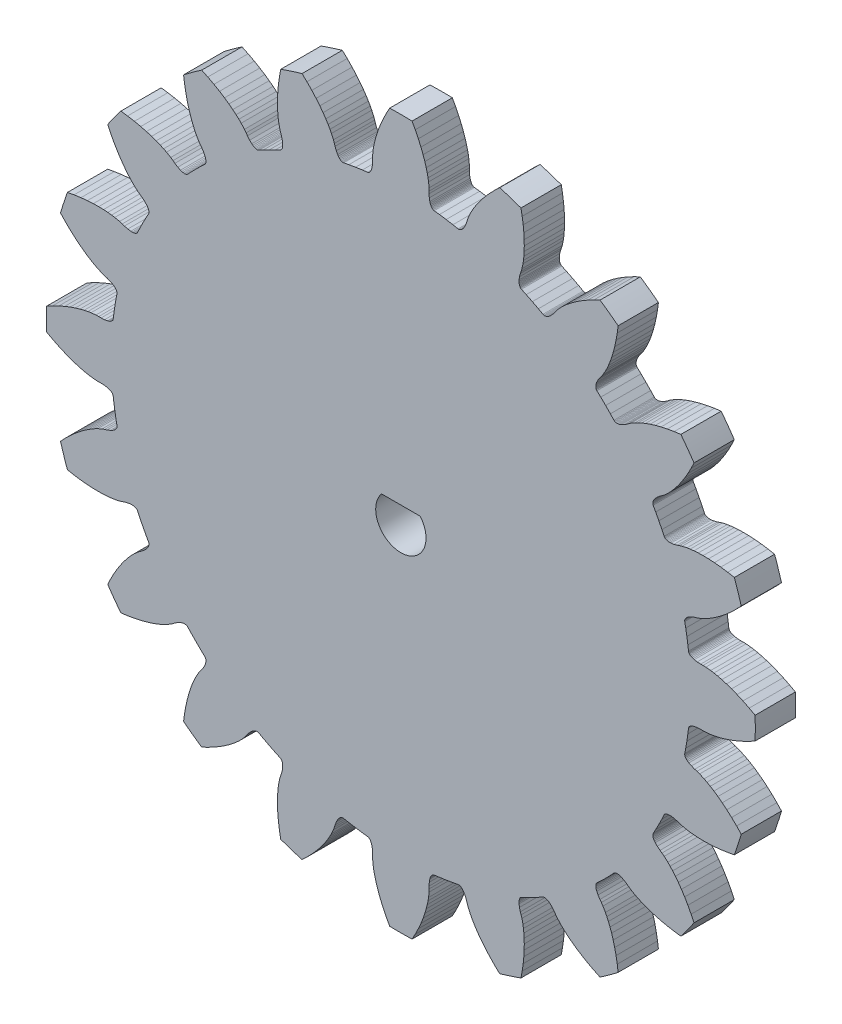
from build123d import *

# Parameters (mm, degrees)
MODEL_R             = 0.5
BOSS_EXTRUDE1_DEPTH = 5
CUT_EXTRUDE1_DEPTH  = 63.425869445
BOSS_EXTRUDE2_START = 10
SKETCH3_R           = 8
BOSS_EXTRUDE2_DEPTH = 10
SKETCH5_R           = 2.05
CUT_EXTRUDE2_DEPTH  = 10


with BuildPart() as part:
    # Model → Boss-Extrude1 (new body)
    with BuildSketch(Plane.XY):
        with BuildLine():
            Line((41.0580513, 11.0594647), (41.6786239, 11.6621942))
            Line((41.6786239, 11.6621942), (42.254799591, 12.268924064))
            ThreePointArc((42.254799591, 12.268924064), (41.846428175, 13.596728691), (41.396343585, 14.910979886))
            Line((41.396343585, 14.910979886), (40.5735808, 15.0631672))
            Line((40.5735808, 15.0631672), (39.7172515, 15.1860222))
            Line((39.7172515, 15.1860222), (38.9209581, 15.2664261))
            Line((38.9209581, 15.2664261), (38.188074, 15.3095207))
            Line((38.188074, 15.3095207), (37.5212498, 15.3207867))
            Line((37.5212498, 15.3207867), (36.9192091, 15.3057692))
            Line((36.9192091, 15.3057692), (36.385219, 15.2700607))
            Line((36.385219, 15.2700607), (35.9182805, 15.2191681))
            Line((35.9182805, 15.2191681), (35.519022, 15.1586865))
            Line((35.519022, 15.1586865), (34.9229912, 15.031255))
            Line((34.9229912, 15.031255), (34.5912709, 14.9315723))
            Line((34.5912709, 14.9315723), (34.3145829, 14.8346777))
            Line((34.3145829, 14.8346777), (33.8996768, 14.7245961))
            Line((33.8996768, 14.7245961), (33.5375203, 14.6729516))
            Line((33.5375203, 14.6729516), (33.3775076, 14.6675821))
            Line((33.3775076, 14.6675821), (33.232174, 14.6750343))
            Line((33.232174, 14.6750343), (33.1019936, 14.6947079))
            Line((33.1019936, 14.6947079), (32.9874095, 14.7259534))
            Line((32.9874095, 14.7259534), (32.8888203, 14.7681208))
            Line((32.8888203, 14.7681208), (32.8066469, 14.8205604))
            Line((32.8066469, 14.8205604), (32.74127, 14.8825908))
            Line((32.74127, 14.8825908), (32.6837041, 14.9725741))
            Line((32.6837041, 14.9725741), (32.4071065, 15.5624769))
            Line((32.4071065, 15.5624769), (32.0316845, 16.3209585))
            Line((32.0316845, 16.3209585), (31.6387276, 17.0705055))
            Line((31.6387276, 17.0705055), (31.3240661, 17.6410139))
            Line((31.3240661, 17.6410139), (31.2851045, 17.7404764))
            Line((31.2851045, 17.7404764), (31.2733484, 17.829828))
            Line((31.2733484, 17.829828), (31.2792242, 17.927131))
            Line((31.2792242, 17.927131), (31.3030593, 18.0316767))
            Line((31.3030593, 18.0316767), (31.345132, 18.1427428))
            Line((31.345132, 18.1427428), (31.4057339, 18.2596248))
            Line((31.4057339, 18.2596248), (31.48513, 18.3815824))
            Line((31.48513, 18.3815824), (31.583527, 18.5078793))
            Line((31.583527, 18.5078793), (31.8381786, 18.7705142))
            Line((31.8381786, 18.7705142), (32.1711122, 19.0414759))
            Line((32.1711122, 19.0414759), (32.4121346, 19.208368))
            Line((32.4121346, 19.208368), (32.6877599, 19.4181434))
            Line((32.6877599, 19.4181434), (33.1411923, 19.8254401))
            Line((33.1411923, 19.8254401), (33.4248012, 20.1128967))
            Line((33.4248012, 20.1128967), (33.7404338, 20.460744))
            Line((33.7404338, 20.460744), (34.083194, 20.8717622))
            Line((34.083194, 20.8717622), (34.4492141, 21.3499962))
            Line((34.4492141, 21.3499962), (34.8320491, 21.8960904))
            Line((34.8320491, 21.8960904), (35.2279633, 22.5143365))
            Line((35.2279633, 22.5143365), (35.6309647, 23.2058115))
            Line((35.6309647, 23.2058115), (36.0349107, 23.9708089))
            Line((36.0349107, 23.9708089), (36.395396459, 24.725891411))
            ThreePointArc((36.395396459, 24.725891411), (35.596697995, 25.862514918), (34.762516187, 26.973358268))
            Line((34.762516187, 26.973358268), (33.9329938, 26.8638493))
            Line((33.9329938, 26.8638493), (33.0806119, 26.716071))
            Line((33.0806119, 26.716071), (32.2984457, 26.5464715))
            Line((32.2984457, 26.5464715), (31.5881145, 26.3609832))
            Line((31.5881145, 26.3609832), (30.9504457, 26.1656379))
            Line((30.9504457, 26.1656379), (30.3825116, 25.9653146))
            Line((30.3825116, 25.9653146), (29.8856913, 25.7663418))
            Line((29.8856913, 25.7663418), (29.4573331, 25.5736481))
            Line((29.4573331, 25.5736481), (29.0963056, 25.392749))
            Line((29.0963056, 25.392749), (28.5688252, 25.0873708))
            Line((28.5688252, 25.0873708), (28.284144, 24.8900597))
            Line((28.284144, 24.8900597), (28.0509402, 24.7124062))
            Line((28.0509402, 24.7124062), (27.6903581, 24.4794994))
            Line((27.6903581, 24.4794994), (27.3618858, 24.3184699))
            Line((27.3618858, 24.3184699), (27.211364, 24.2639166))
            Line((27.211364, 24.2639166), (27.0708407, 24.2260935))
            Line((27.0708407, 24.2260935), (26.9409522, 24.2045762))
            Line((26.9409522, 24.2045762), (26.8223209, 24.198884))
            Line((26.8223209, 24.198884), (26.7155266, 24.2085219))
            Line((26.7155266, 24.2085219), (26.6211702, 24.2330019))
            Line((26.6211702, 24.2330019), (26.5398247, 24.2717938))
            Line((26.5398247, 24.2717938), (26.45727, 24.3395841))
            Line((26.45727, 24.3395841), (26.01192, 24.8151417))
            Line((26.01192, 24.8151417), (25.4204888, 25.4204888))
            Line((25.4204888, 25.4204888), (24.8151417, 26.01192))
            Line((24.8151417, 26.01192), (24.3395841, 26.45727))
            Line((24.3395841, 26.45727), (24.2717938, 26.5398247))
            Line((24.2717938, 26.5398247), (24.2330019, 26.6211702))
            Line((24.2330019, 26.6211702), (24.2085219, 26.7155266))
            Line((24.2085219, 26.7155266), (24.198884, 26.8223209))
            Line((24.198884, 26.8223209), (24.2045762, 26.9409522))
            Line((24.2045762, 26.9409522), (24.2260935, 27.0708407))
            Line((24.2260935, 27.0708407), (24.2639166, 27.211364))
            Line((24.2639166, 27.211364), (24.3184699, 27.3618858))
            Line((24.3184699, 27.3618858), (24.4794994, 27.6903581))
            Line((24.4794994, 27.6903581), (24.7124062, 28.0509402))
            Line((24.7124062, 28.0509402), (24.8900597, 28.284144))
            Line((24.8900597, 28.284144), (25.0873708, 28.5688252))
            Line((25.0873708, 28.5688252), (25.392749, 29.0963056))
            Line((25.392749, 29.0963056), (25.5736481, 29.4573331))
            Line((25.5736481, 29.4573331), (25.7663418, 29.8856913))
            Line((25.7663418, 29.8856913), (25.9653146, 30.3825116))
            Line((25.9653146, 30.3825116), (26.1656379, 30.9504457))
            Line((26.1656379, 30.9504457), (26.3609832, 31.5881145))
            Line((26.3609832, 31.5881145), (26.5464715, 32.2984457))
            Line((26.5464715, 32.2984457), (26.716071, 33.0806119))
            Line((26.716071, 33.0806119), (26.8638493, 33.9329938))
            Line((26.8638493, 33.9329938), (26.973358307, 34.762516234))
            ThreePointArc((26.973358307, 34.762516234), (25.862514956, 35.59669804), (24.725891448, 36.395396503))
            Line((24.725891448, 36.395396503), (23.9708089, 36.0349107))
            Line((23.9708089, 36.0349107), (23.2058115, 35.6309647))
            Line((23.2058115, 35.6309647), (22.5143365, 35.2279633))
            Line((22.5143365, 35.2279633), (21.8960904, 34.8320491))
            Line((21.8960904, 34.8320491), (21.3499962, 34.4492141))
            Line((21.3499962, 34.4492141), (20.8717622, 34.083194))
            Line((20.8717622, 34.083194), (20.460744, 33.7404338))
            Line((20.460744, 33.7404338), (20.1128967, 33.4248012))
            Line((20.1128967, 33.4248012), (19.8254401, 33.1411923))
            Line((19.8254401, 33.1411923), (19.4181434, 32.6877599))
            Line((19.4181434, 32.6877599), (19.208368, 32.4121346))
            Line((19.208368, 32.4121346), (19.0414759, 32.1711122))
            Line((19.0414759, 32.1711122), (18.7705142, 31.8381786))
            Line((18.7705142, 31.8381786), (18.5078793, 31.583527))
            Line((18.5078793, 31.583527), (18.3815824, 31.48513))
            Line((18.3815824, 31.48513), (18.2596248, 31.4057339))
            Line((18.2596248, 31.4057339), (18.1427428, 31.345132))
            Line((18.1427428, 31.345132), (18.0316767, 31.3030593))
            Line((18.0316767, 31.3030593), (17.927131, 31.2792242))
            Line((17.927131, 31.2792242), (17.829828, 31.2733484))
            Line((17.829828, 31.2733484), (17.7404764, 31.2851045))
            Line((17.7404764, 31.2851045), (17.6410139, 31.3240661))
            Line((17.6410139, 31.3240661), (17.0705055, 31.6387276))
            Line((17.0705055, 31.6387276), (16.3209585, 32.0316845))
            Line((16.3209585, 32.0316845), (15.5624769, 32.4071065))
            Line((15.5624769, 32.4071065), (14.9725741, 32.6837041))
            Line((14.9725741, 32.6837041), (14.8825908, 32.74127))
            Line((14.8825908, 32.74127), (14.8205604, 32.8066469))
            Line((14.8205604, 32.8066469), (14.7681208, 32.8888203))
            Line((14.7681208, 32.8888203), (14.7259534, 32.9874095))
            Line((14.7259534, 32.9874095), (14.6947079, 33.1019936))
            Line((14.6947079, 33.1019936), (14.6750343, 33.232174))
            Line((14.6750343, 33.232174), (14.6675821, 33.3775076))
            Line((14.6675821, 33.3775076), (14.6729516, 33.5375203))
            Line((14.6729516, 33.5375203), (14.7245961, 33.8996768))
            Line((14.7245961, 33.8996768), (14.8346777, 34.3145829))
            Line((14.8346777, 34.3145829), (14.9315723, 34.5912709))
            Line((14.9315723, 34.5912709), (15.031255, 34.9229912))
            Line((15.031255, 34.9229912), (15.1586865, 35.519022))
            Line((15.1586865, 35.519022), (15.2191681, 35.9182805))
            Line((15.2191681, 35.9182805), (15.2700607, 36.385219))
            Line((15.2700607, 36.385219), (15.3057692, 36.9192091))
            Line((15.3057692, 36.9192091), (15.3207867, 37.5212498))
            Line((15.3207867, 37.5212498), (15.3095207, 38.188074))
            Line((15.3095207, 38.188074), (15.2664261, 38.9209581))
            Line((15.2664261, 38.9209581), (15.1860222, 39.7172515))
            Line((15.1860222, 39.7172515), (15.0631672, 40.5735808))
            Line((15.0631672, 40.5735808), (14.910979886, 41.396343585))
            ThreePointArc((14.910979886, 41.396343585), (13.596728691, 41.846428175), (12.268924064, 42.254799591))
            Line((12.268924064, 42.254799591), (11.6621942, 41.6786239))
            Line((11.6621942, 41.6786239), (11.0594647, 41.0580513))
            Line((11.0594647, 41.0580513), (10.5263671, 40.4610966))
            Line((10.5263671, 40.4610966), (10.0607243, 39.8935113))
            Line((10.0607243, 39.8935113), (9.6596604, 39.3606612))
            Line((9.6596604, 39.3606612), (9.3179393, 38.864773))
            Line((9.3179393, 38.864773), (9.0329565, 38.411777))
            Line((9.0329565, 38.411777), (8.7996699, 38.0041019))
            Line((8.7996699, 38.0041019), (8.6139223, 37.6455448))
            Line((8.6139223, 37.6455448), (8.3666785, 37.0884434))
            Line((8.3666785, 37.0884434), (8.2523431, 36.761484))
            Line((8.2523431, 36.761484), (8.1680994, 36.4806855))
            Line((8.1680994, 36.4806855), (8.0132816, 36.0803151))
            Line((8.0132816, 36.0803151), (7.8421926, 35.7569684))
            Line((7.8421926, 35.7569684), (7.7524835, 35.6243594))
            Line((7.7524835, 35.6243594), (7.6610297, 35.5111623))
            Line((7.6610297, 35.5111623), (7.5685952, 35.4174079))
            Line((7.5685952, 35.4174079), (7.4759663, 35.3430731))
            Line((7.4759663, 35.3430731), (7.3839029, 35.2880982))
            Line((7.3839029, 35.2880982), (7.293178, 35.2524417))
            Line((7.293178, 35.2524417), (7.2045667, 35.2360112))
            Line((7.2045667, 35.2360112), (7.0979324, 35.2423303))
            Line((7.0979324, 35.2423303), (6.458111, 35.3652943))
            Line((6.458111, 35.3652943), (5.623819, 35.5073958))
            Line((5.623819, 35.5073958), (4.7864484, 35.6300597))
            Line((4.7864484, 35.6300597), (4.1399441, 35.7108296))
            Line((4.1399441, 35.7108296), (4.0365761, 35.7377716))
            Line((4.0365761, 35.7377716), (3.9573791, 35.7807803))
            Line((3.9573791, 35.7807803), (3.8821131, 35.8427272))
            Line((3.8821131, 35.8427272), (3.8115438, 35.9234606))
            Line((3.8115438, 35.9234606), (3.7464191, 36.0227811))
            Line((3.7464191, 36.0227811), (3.6874804, 36.1405106))
            Line((3.6874804, 36.1405106), (3.6354825, 36.2764283))
            Line((3.6354825, 36.2764283), (3.5911425, 36.4302686))
            Line((3.5911425, 36.4302686), (3.5283469, 36.790659))
            Line((3.5283469, 36.790659), (3.5048276, 37.2192752))
            Line((3.5048276, 37.2192752), (3.5114786, 37.5123632))
            Line((3.5114786, 37.5123632), (3.5037752, 37.8586516))
            Line((3.5037752, 37.8586516), (3.4407861, 38.4648891))
            Line((3.4407861, 38.4648891), (3.37493, 38.8632963))
            Line((3.37493, 38.8632963), (3.2790398, 39.3231079))
            Line((3.2790398, 39.3231079), (3.1479885, 39.8419972))
            Line((3.1479885, 39.8419972), (2.9762302, 40.4192126))
            Line((2.9762302, 40.4192126), (2.7594555, 41.0499187))
            Line((2.7594555, 41.0499187), (2.4919965, 41.7336159))
            Line((2.4919965, 41.7336159), (2.1694597, 42.4660898))
            Line((2.1694597, 42.4660898), (1.7879973, 43.2425431))
            Line((1.7879973, 43.2425431), (1.389010873, 43.978008589))
            ThreePointArc((1.389010873, 43.978008589), (-7.7e-08, 43.9999385), (-1.389011027, 43.978008585))
            Line((-1.389011027, 43.978008585), (-1.7879973, 43.2425431))
            Line((-1.7879973, 43.2425431), (-2.1694597, 42.4660898))
            Line((-2.1694597, 42.4660898), (-2.4919965, 41.7336159))
            Line((-2.4919965, 41.7336159), (-2.7594555, 41.0499187))
            Line((-2.7594555, 41.0499187), (-2.9762302, 40.4192126))
            Line((-2.9762302, 40.4192126), (-3.1479885, 39.8419972))
            Line((-3.1479885, 39.8419972), (-3.2790398, 39.3231079))
            Line((-3.2790398, 39.3231079), (-3.37493, 38.8632963))
            Line((-3.37493, 38.8632963), (-3.4407861, 38.4648891))
            Line((-3.4407861, 38.4648891), (-3.5037752, 37.8586516))
            Line((-3.5037752, 37.8586516), (-3.5114786, 37.5123632))
            Line((-3.5114786, 37.5123632), (-3.5048276, 37.2192752))
            Line((-3.5048276, 37.2192752), (-3.5283469, 36.790659))
            Line((-3.5283469, 36.790659), (-3.5911425, 36.4302686))
            Line((-3.5911425, 36.4302686), (-3.6354825, 36.2764283))
            Line((-3.6354825, 36.2764283), (-3.6874804, 36.1405106))
            Line((-3.6874804, 36.1405106), (-3.7464191, 36.0227811))
            Line((-3.7464191, 36.0227811), (-3.8115438, 35.9234606))
            Line((-3.8115438, 35.9234606), (-3.8821131, 35.8427272))
            Line((-3.8821131, 35.8427272), (-3.9573791, 35.7807803))
            Line((-3.9573791, 35.7807803), (-4.0365761, 35.7377716))
            Line((-4.0365761, 35.7377716), (-4.1399441, 35.7108296))
            Line((-4.1399441, 35.7108296), (-4.7864484, 35.6300597))
            Line((-4.7864484, 35.6300597), (-5.623819, 35.5073958))
            Line((-5.623819, 35.5073958), (-6.458111, 35.3652943))
            Line((-6.458111, 35.3652943), (-7.0979324, 35.2423303))
            Line((-7.0979324, 35.2423303), (-7.2045667, 35.2360112))
            Line((-7.2045667, 35.2360112), (-7.293178, 35.2524417))
            Line((-7.293178, 35.2524417), (-7.3839029, 35.2880982))
            Line((-7.3839029, 35.2880982), (-7.4759663, 35.3430731))
            Line((-7.4759663, 35.3430731), (-7.5685952, 35.4174079))
            Line((-7.5685952, 35.4174079), (-7.6610297, 35.5111623))
            Line((-7.6610297, 35.5111623), (-7.7524835, 35.6243594))
            Line((-7.7524835, 35.6243594), (-7.8421926, 35.7569684))
            Line((-7.8421926, 35.7569684), (-8.0132816, 36.0803151))
            Line((-8.0132816, 36.0803151), (-8.1680994, 36.4806855))
            Line((-8.1680994, 36.4806855), (-8.2523431, 36.761484))
            Line((-8.2523431, 36.761484), (-8.3666785, 37.0884434))
            Line((-8.3666785, 37.0884434), (-8.6139223, 37.6455448))
            Line((-8.6139223, 37.6455448), (-8.7996699, 38.0041019))
            Line((-8.7996699, 38.0041019), (-9.0329565, 38.411777))
            Line((-9.0329565, 38.411777), (-9.3179393, 38.864773))
            Line((-9.3179393, 38.864773), (-9.6596604, 39.3606612))
            Line((-9.6596604, 39.3606612), (-10.0607243, 39.8935113))
            Line((-10.0607243, 39.8935113), (-10.5263671, 40.4610966))
            Line((-10.5263671, 40.4610966), (-11.0594647, 41.0580513))
            Line((-11.0594647, 41.0580513), (-11.6621942, 41.6786239))
            Line((-11.6621942, 41.6786239), (-12.268924064, 42.254799591))
            ThreePointArc((-12.268924064, 42.254799591), (-13.596728691, 41.846428175), (-14.910979886, 41.396343585))
            Line((-14.910979886, 41.396343585), (-15.0631672, 40.5735808))
            Line((-15.0631672, 40.5735808), (-15.1860222, 39.7172515))
            Line((-15.1860222, 39.7172515), (-15.2664261, 38.9209581))
            Line((-15.2664261, 38.9209581), (-15.3095207, 38.188074))
            Line((-15.3095207, 38.188074), (-15.3207867, 37.5212498))
            Line((-15.3207867, 37.5212498), (-15.3057692, 36.9192091))
            Line((-15.3057692, 36.9192091), (-15.2700607, 36.385219))
            Line((-15.2700607, 36.385219), (-15.2191681, 35.9182805))
            Line((-15.2191681, 35.9182805), (-15.1586865, 35.519022))
            Line((-15.1586865, 35.519022), (-15.031255, 34.9229912))
            Line((-15.031255, 34.9229912), (-14.9315723, 34.5912709))
            Line((-14.9315723, 34.5912709), (-14.8346777, 34.3145829))
            Line((-14.8346777, 34.3145829), (-14.7245961, 33.8996768))
            Line((-14.7245961, 33.8996768), (-14.6729516, 33.5375203))
            Line((-14.6729516, 33.5375203), (-14.6675821, 33.3775076))
            Line((-14.6675821, 33.3775076), (-14.6750343, 33.232174))
            Line((-14.6750343, 33.232174), (-14.6947079, 33.1019936))
            Line((-14.6947079, 33.1019936), (-14.7259534, 32.9874095))
            Line((-14.7259534, 32.9874095), (-14.7681208, 32.8888203))
            Line((-14.7681208, 32.8888203), (-14.8205604, 32.8066469))
            Line((-14.8205604, 32.8066469), (-14.8825908, 32.74127))
            Line((-14.8825908, 32.74127), (-14.9725741, 32.6837041))
            Line((-14.9725741, 32.6837041), (-15.5624769, 32.4071065))
            Line((-15.5624769, 32.4071065), (-16.3209585, 32.0316845))
            Line((-16.3209585, 32.0316845), (-17.0705055, 31.6387276))
            Line((-17.0705055, 31.6387276), (-17.6410139, 31.3240661))
            Line((-17.6410139, 31.3240661), (-17.7404764, 31.2851045))
            Line((-17.7404764, 31.2851045), (-17.829828, 31.2733484))
            Line((-17.829828, 31.2733484), (-17.927131, 31.2792242))
            Line((-17.927131, 31.2792242), (-18.0316767, 31.3030593))
            Line((-18.0316767, 31.3030593), (-18.1427428, 31.345132))
            Line((-18.1427428, 31.345132), (-18.2596248, 31.4057339))
            Line((-18.2596248, 31.4057339), (-18.3815824, 31.48513))
            Line((-18.3815824, 31.48513), (-18.5078793, 31.583527))
            Line((-18.5078793, 31.583527), (-18.7705142, 31.8381786))
            Line((-18.7705142, 31.8381786), (-19.0414759, 32.1711122))
            Line((-19.0414759, 32.1711122), (-19.208368, 32.4121346))
            Line((-19.208368, 32.4121346), (-19.4181434, 32.6877599))
            Line((-19.4181434, 32.6877599), (-19.8254401, 33.1411923))
            Line((-19.8254401, 33.1411923), (-20.1128967, 33.4248012))
            Line((-20.1128967, 33.4248012), (-20.460744, 33.7404338))
            Line((-20.460744, 33.7404338), (-20.8717622, 34.083194))
            Line((-20.8717622, 34.083194), (-21.3499962, 34.4492141))
            Line((-21.3499962, 34.4492141), (-21.8960904, 34.8320491))
            Line((-21.8960904, 34.8320491), (-22.5143365, 35.2279633))
            Line((-22.5143365, 35.2279633), (-23.2058115, 35.6309647))
            Line((-23.2058115, 35.6309647), (-23.9708089, 36.0349107))
            Line((-23.9708089, 36.0349107), (-24.725891411, 36.395396459))
            ThreePointArc((-24.725891411, 36.395396459), (-25.862514918, 35.596697995), (-26.973358268, 34.762516187))
            Line((-26.973358268, 34.762516187), (-26.8638493, 33.9329938))
            Line((-26.8638493, 33.9329938), (-26.716071, 33.0806119))
            Line((-26.716071, 33.0806119), (-26.5464715, 32.2984457))
            Line((-26.5464715, 32.2984457), (-26.3609832, 31.5881145))
            Line((-26.3609832, 31.5881145), (-26.1656379, 30.9504457))
            Line((-26.1656379, 30.9504457), (-25.9653146, 30.3825116))
            Line((-25.9653146, 30.3825116), (-25.7663418, 29.8856913))
            Line((-25.7663418, 29.8856913), (-25.5736481, 29.4573331))
            Line((-25.5736481, 29.4573331), (-25.392749, 29.0963056))
            Line((-25.392749, 29.0963056), (-25.0873708, 28.5688252))
            Line((-25.0873708, 28.5688252), (-24.8900597, 28.284144))
            Line((-24.8900597, 28.284144), (-24.7124062, 28.0509402))
            Line((-24.7124062, 28.0509402), (-24.4794994, 27.6903581))
            Line((-24.4794994, 27.6903581), (-24.3184699, 27.3618858))
            Line((-24.3184699, 27.3618858), (-24.2639166, 27.211364))
            Line((-24.2639166, 27.211364), (-24.2260935, 27.0708407))
            Line((-24.2260935, 27.0708407), (-24.2045762, 26.9409522))
            Line((-24.2045762, 26.9409522), (-24.198884, 26.8223209))
            Line((-24.198884, 26.8223209), (-24.2085219, 26.7155266))
            Line((-24.2085219, 26.7155266), (-24.2330019, 26.6211702))
            Line((-24.2330019, 26.6211702), (-24.2717938, 26.5398247))
            Line((-24.2717938, 26.5398247), (-24.3395841, 26.45727))
            Line((-24.3395841, 26.45727), (-24.8151417, 26.01192))
            Line((-24.8151417, 26.01192), (-25.4204888, 25.4204888))
            Line((-25.4204888, 25.4204888), (-26.01192, 24.8151417))
            Line((-26.01192, 24.8151417), (-26.45727, 24.3395841))
            Line((-26.45727, 24.3395841), (-26.5398247, 24.2717938))
            Line((-26.5398247, 24.2717938), (-26.6211702, 24.2330019))
            Line((-26.6211702, 24.2330019), (-26.7155266, 24.2085219))
            Line((-26.7155266, 24.2085219), (-26.8223209, 24.198884))
            Line((-26.8223209, 24.198884), (-26.9409522, 24.2045762))
            Line((-26.9409522, 24.2045762), (-27.0708407, 24.2260935))
            Line((-27.0708407, 24.2260935), (-27.211364, 24.2639166))
            Line((-27.211364, 24.2639166), (-27.3618858, 24.3184699))
            Line((-27.3618858, 24.3184699), (-27.6903581, 24.4794994))
            Line((-27.6903581, 24.4794994), (-28.0509402, 24.7124062))
            Line((-28.0509402, 24.7124062), (-28.284144, 24.8900597))
            Line((-28.284144, 24.8900597), (-28.5688252, 25.0873708))
            Line((-28.5688252, 25.0873708), (-29.0963056, 25.392749))
            Line((-29.0963056, 25.392749), (-29.4573331, 25.5736481))
            Line((-29.4573331, 25.5736481), (-29.8856913, 25.7663418))
            Line((-29.8856913, 25.7663418), (-30.3825116, 25.9653146))
            Line((-30.3825116, 25.9653146), (-30.9504457, 26.1656379))
            Line((-30.9504457, 26.1656379), (-31.5881145, 26.3609832))
            Line((-31.5881145, 26.3609832), (-32.2984457, 26.5464715))
            Line((-32.2984457, 26.5464715), (-33.0806119, 26.716071))
            Line((-33.0806119, 26.716071), (-33.9329938, 26.8638493))
            Line((-33.9329938, 26.8638493), (-34.762516234, 26.973358307))
            ThreePointArc((-34.762516234, 26.973358307), (-35.59669804, 25.862514956), (-36.395396503, 24.725891448))
            Line((-36.395396503, 24.725891448), (-36.0349107, 23.9708089))
            Line((-36.0349107, 23.9708089), (-35.6309647, 23.2058115))
            Line((-35.6309647, 23.2058115), (-35.2279633, 22.5143365))
            Line((-35.2279633, 22.5143365), (-34.8320491, 21.8960904))
            Line((-34.8320491, 21.8960904), (-34.4492141, 21.3499962))
            Line((-34.4492141, 21.3499962), (-34.083194, 20.8717622))
            Line((-34.083194, 20.8717622), (-33.7404338, 20.460744))
            Line((-33.7404338, 20.460744), (-33.4248012, 20.1128967))
            Line((-33.4248012, 20.1128967), (-33.1411923, 19.8254401))
            Line((-33.1411923, 19.8254401), (-32.6877599, 19.4181434))
            Line((-32.6877599, 19.4181434), (-32.4121346, 19.208368))
            Line((-32.4121346, 19.208368), (-32.1711122, 19.0414759))
            Line((-32.1711122, 19.0414759), (-31.8381786, 18.7705142))
            Line((-31.8381786, 18.7705142), (-31.583527, 18.5078793))
            Line((-31.583527, 18.5078793), (-31.48513, 18.3815824))
            Line((-31.48513, 18.3815824), (-31.4057339, 18.2596248))
            Line((-31.4057339, 18.2596248), (-31.345132, 18.1427428))
            Line((-31.345132, 18.1427428), (-31.3030593, 18.0316767))
            Line((-31.3030593, 18.0316767), (-31.2792242, 17.927131))
            Line((-31.2792242, 17.927131), (-31.2733484, 17.829828))
            Line((-31.2733484, 17.829828), (-31.2851045, 17.7404764))
            Line((-31.2851045, 17.7404764), (-31.3240661, 17.6410139))
            Line((-31.3240661, 17.6410139), (-31.6387276, 17.0705055))
            Line((-31.6387276, 17.0705055), (-32.0316845, 16.3209585))
            Line((-32.0316845, 16.3209585), (-32.4071065, 15.5624769))
            Line((-32.4071065, 15.5624769), (-32.6837041, 14.9725741))
            Line((-32.6837041, 14.9725741), (-32.74127, 14.8825908))
            Line((-32.74127, 14.8825908), (-32.8066469, 14.8205604))
            Line((-32.8066469, 14.8205604), (-32.8888203, 14.7681208))
            Line((-32.8888203, 14.7681208), (-32.9874095, 14.7259534))
            Line((-32.9874095, 14.7259534), (-33.1019936, 14.6947079))
            Line((-33.1019936, 14.6947079), (-33.232174, 14.6750343))
            Line((-33.232174, 14.6750343), (-33.3775076, 14.6675821))
            Line((-33.3775076, 14.6675821), (-33.5375203, 14.6729516))
            Line((-33.5375203, 14.6729516), (-33.8996768, 14.7245961))
            Line((-33.8996768, 14.7245961), (-34.3145829, 14.8346777))
            Line((-34.3145829, 14.8346777), (-34.5912709, 14.9315723))
            Line((-34.5912709, 14.9315723), (-34.9229912, 15.031255))
            Line((-34.9229912, 15.031255), (-35.519022, 15.1586865))
            Line((-35.519022, 15.1586865), (-35.9182805, 15.2191681))
            Line((-35.9182805, 15.2191681), (-36.385219, 15.2700607))
            Line((-36.385219, 15.2700607), (-36.9192091, 15.3057692))
            Line((-36.9192091, 15.3057692), (-37.5212498, 15.3207867))
            Line((-37.5212498, 15.3207867), (-38.188074, 15.3095207))
            Line((-38.188074, 15.3095207), (-38.9209581, 15.2664261))
            Line((-38.9209581, 15.2664261), (-39.7172515, 15.1860222))
            Line((-39.7172515, 15.1860222), (-40.5735808, 15.0631672))
            Line((-40.5735808, 15.0631672), (-41.396343585, 14.910979886))
            ThreePointArc((-41.396343585, 14.910979886), (-41.846428175, 13.596728691), (-42.254799591, 12.268924064))
            Line((-42.254799591, 12.268924064), (-41.6786239, 11.6621942))
            Line((-41.6786239, 11.6621942), (-41.0580513, 11.0594647))
            Line((-41.0580513, 11.0594647), (-40.4610966, 10.5263671))
            Line((-40.4610966, 10.5263671), (-39.8935113, 10.0607243))
            Line((-39.8935113, 10.0607243), (-39.3606612, 9.6596604))
            Line((-39.3606612, 9.6596604), (-38.864773, 9.3179393))
            Line((-38.864773, 9.3179393), (-38.411777, 9.0329565))
            Line((-38.411777, 9.0329565), (-38.0041019, 8.7996699))
            Line((-38.0041019, 8.7996699), (-37.6455448, 8.6139223))
            Line((-37.6455448, 8.6139223), (-37.0884434, 8.3666785))
            Line((-37.0884434, 8.3666785), (-36.761484, 8.2523431))
            Line((-36.761484, 8.2523431), (-36.4806855, 8.1680994))
            Line((-36.4806855, 8.1680994), (-36.0803151, 8.0132816))
            Line((-36.0803151, 8.0132816), (-35.7569684, 7.8421926))
            Line((-35.7569684, 7.8421926), (-35.6243594, 7.7524835))
            Line((-35.6243594, 7.7524835), (-35.5111623, 7.6610297))
            Line((-35.5111623, 7.6610297), (-35.4174079, 7.5685952))
            Line((-35.4174079, 7.5685952), (-35.3430731, 7.4759663))
            Line((-35.3430731, 7.4759663), (-35.2880982, 7.3839029))
            Line((-35.2880982, 7.3839029), (-35.2524417, 7.293178))
            Line((-35.2524417, 7.293178), (-35.2360112, 7.2045667))
            Line((-35.2360112, 7.2045667), (-35.2423303, 7.0979324))
            Line((-35.2423303, 7.0979324), (-35.3652943, 6.458111))
            Line((-35.3652943, 6.458111), (-35.5073958, 5.623819))
            Line((-35.5073958, 5.623819), (-35.6300597, 4.7864484))
            Line((-35.6300597, 4.7864484), (-35.7108296, 4.1399441))
            Line((-35.7108296, 4.1399441), (-35.7377716, 4.0365761))
            Line((-35.7377716, 4.0365761), (-35.7807803, 3.9573791))
            Line((-35.7807803, 3.9573791), (-35.8427272, 3.8821131))
            Line((-35.8427272, 3.8821131), (-35.9234606, 3.8115438))
            Line((-35.9234606, 3.8115438), (-36.0227811, 3.7464191))
            Line((-36.0227811, 3.7464191), (-36.1405106, 3.6874804))
            Line((-36.1405106, 3.6874804), (-36.2764283, 3.6354825))
            Line((-36.2764283, 3.6354825), (-36.4302686, 3.5911425))
            Line((-36.4302686, 3.5911425), (-36.790659, 3.5283469))
            Line((-36.790659, 3.5283469), (-37.2192752, 3.5048276))
            Line((-37.2192752, 3.5048276), (-37.5123632, 3.5114786))
            Line((-37.5123632, 3.5114786), (-37.8586516, 3.5037752))
            Line((-37.8586516, 3.5037752), (-38.4648891, 3.4407861))
            Line((-38.4648891, 3.4407861), (-38.8632963, 3.37493))
            Line((-38.8632963, 3.37493), (-39.3231079, 3.2790398))
            Line((-39.3231079, 3.2790398), (-39.8419972, 3.1479885))
            Line((-39.8419972, 3.1479885), (-40.4192126, 2.9762302))
            Line((-40.4192126, 2.9762302), (-41.0499187, 2.7594555))
            Line((-41.0499187, 2.7594555), (-41.7336159, 2.4919965))
            Line((-41.7336159, 2.4919965), (-42.4660898, 2.1694597))
            Line((-42.4660898, 2.1694597), (-43.2425431, 1.7879973))
            Line((-43.2425431, 1.7879973), (-43.978008589, 1.389010873))
            ThreePointArc((-43.978008589, 1.389010873), (-43.9999385, -7.7e-08), (-43.978008585, -1.389011027))
            Line((-43.978008585, -1.389011027), (-43.2425431, -1.7879973))
            Line((-43.2425431, -1.7879973), (-42.4660898, -2.1694597))
            Line((-42.4660898, -2.1694597), (-41.7336159, -2.4919965))
            Line((-41.7336159, -2.4919965), (-41.0499187, -2.7594555))
            Line((-41.0499187, -2.7594555), (-40.4192126, -2.9762302))
            Line((-40.4192126, -2.9762302), (-39.8419972, -3.1479885))
            Line((-39.8419972, -3.1479885), (-39.3231079, -3.2790398))
            Line((-39.3231079, -3.2790398), (-38.8632963, -3.37493))
            Line((-38.8632963, -3.37493), (-38.4648891, -3.4407861))
            Line((-38.4648891, -3.4407861), (-37.8586516, -3.5037752))
            Line((-37.8586516, -3.5037752), (-37.5123632, -3.5114786))
            Line((-37.5123632, -3.5114786), (-37.2192752, -3.5048276))
            Line((-37.2192752, -3.5048276), (-36.790659, -3.5283469))
            Line((-36.790659, -3.5283469), (-36.4302686, -3.5911425))
            Line((-36.4302686, -3.5911425), (-36.2764283, -3.6354825))
            Line((-36.2764283, -3.6354825), (-36.1405106, -3.6874804))
            Line((-36.1405106, -3.6874804), (-36.0227811, -3.7464191))
            Line((-36.0227811, -3.7464191), (-35.9234606, -3.8115438))
            Line((-35.9234606, -3.8115438), (-35.8427272, -3.8821131))
            Line((-35.8427272, -3.8821131), (-35.7807803, -3.9573791))
            Line((-35.7807803, -3.9573791), (-35.7377716, -4.0365761))
            Line((-35.7377716, -4.0365761), (-35.7108296, -4.1399441))
            Line((-35.7108296, -4.1399441), (-35.6300597, -4.7864484))
            Line((-35.6300597, -4.7864484), (-35.5073958, -5.623819))
            Line((-35.5073958, -5.623819), (-35.3652943, -6.458111))
            Line((-35.3652943, -6.458111), (-35.2423303, -7.0979324))
            Line((-35.2423303, -7.0979324), (-35.2360112, -7.2045667))
            Line((-35.2360112, -7.2045667), (-35.2524417, -7.293178))
            Line((-35.2524417, -7.293178), (-35.2880982, -7.3839029))
            Line((-35.2880982, -7.3839029), (-35.3430731, -7.4759663))
            Line((-35.3430731, -7.4759663), (-35.4174079, -7.5685952))
            Line((-35.4174079, -7.5685952), (-35.5111623, -7.6610297))
            Line((-35.5111623, -7.6610297), (-35.6243594, -7.7524835))
            Line((-35.6243594, -7.7524835), (-35.7569684, -7.8421926))
            Line((-35.7569684, -7.8421926), (-36.0803151, -8.0132816))
            Line((-36.0803151, -8.0132816), (-36.4806855, -8.1680994))
            Line((-36.4806855, -8.1680994), (-36.761484, -8.2523431))
            Line((-36.761484, -8.2523431), (-37.0884434, -8.3666785))
            Line((-37.0884434, -8.3666785), (-37.6455448, -8.6139223))
            Line((-37.6455448, -8.6139223), (-38.0041019, -8.7996699))
            Line((-38.0041019, -8.7996699), (-38.411777, -9.0329565))
            Line((-38.411777, -9.0329565), (-38.864773, -9.3179393))
            Line((-38.864773, -9.3179393), (-39.3606612, -9.6596604))
            Line((-39.3606612, -9.6596604), (-39.8935113, -10.0607243))
            Line((-39.8935113, -10.0607243), (-40.4610966, -10.5263671))
            Line((-40.4610966, -10.5263671), (-41.0580513, -11.0594647))
            Line((-41.0580513, -11.0594647), (-41.6786239, -11.6621942))
            Line((-41.6786239, -11.6621942), (-42.254799591, -12.268924064))
            ThreePointArc((-42.254799591, -12.268924064), (-41.846428175, -13.596728691), (-41.396343585, -14.910979886))
            Line((-41.396343585, -14.910979886), (-40.5735808, -15.0631672))
            Line((-40.5735808, -15.0631672), (-39.7172515, -15.1860222))
            Line((-39.7172515, -15.1860222), (-38.9209581, -15.2664261))
            Line((-38.9209581, -15.2664261), (-38.188074, -15.3095207))
            Line((-38.188074, -15.3095207), (-37.5212498, -15.3207867))
            Line((-37.5212498, -15.3207867), (-36.9192091, -15.3057692))
            Line((-36.9192091, -15.3057692), (-36.385219, -15.2700607))
            Line((-36.385219, -15.2700607), (-35.9182805, -15.2191681))
            Line((-35.9182805, -15.2191681), (-35.519022, -15.1586865))
            Line((-35.519022, -15.1586865), (-34.9229912, -15.031255))
            Line((-34.9229912, -15.031255), (-34.5912709, -14.9315723))
            Line((-34.5912709, -14.9315723), (-34.3145829, -14.8346777))
            Line((-34.3145829, -14.8346777), (-33.8996768, -14.7245961))
            Line((-33.8996768, -14.7245961), (-33.5375203, -14.6729516))
            Line((-33.5375203, -14.6729516), (-33.3775076, -14.6675821))
            Line((-33.3775076, -14.6675821), (-33.232174, -14.6750343))
            Line((-33.232174, -14.6750343), (-33.1019936, -14.6947079))
            Line((-33.1019936, -14.6947079), (-32.9874095, -14.7259534))
            Line((-32.9874095, -14.7259534), (-32.8888203, -14.7681208))
            Line((-32.8888203, -14.7681208), (-32.8066469, -14.8205604))
            Line((-32.8066469, -14.8205604), (-32.74127, -14.8825908))
            Line((-32.74127, -14.8825908), (-32.6837041, -14.9725741))
            Line((-32.6837041, -14.9725741), (-32.4071065, -15.5624769))
            Line((-32.4071065, -15.5624769), (-32.0316845, -16.3209585))
            Line((-32.0316845, -16.3209585), (-31.6387276, -17.0705055))
            Line((-31.6387276, -17.0705055), (-31.3240661, -17.6410139))
            Line((-31.3240661, -17.6410139), (-31.2851045, -17.7404764))
            Line((-31.2851045, -17.7404764), (-31.2733484, -17.829828))
            Line((-31.2733484, -17.829828), (-31.2792242, -17.927131))
            Line((-31.2792242, -17.927131), (-31.3030593, -18.0316767))
            Line((-31.3030593, -18.0316767), (-31.345132, -18.1427428))
            Line((-31.345132, -18.1427428), (-31.4057339, -18.2596248))
            Line((-31.4057339, -18.2596248), (-31.48513, -18.3815824))
            Line((-31.48513, -18.3815824), (-31.583527, -18.5078793))
            Line((-31.583527, -18.5078793), (-31.8381786, -18.7705142))
            Line((-31.8381786, -18.7705142), (-32.1711122, -19.0414759))
            Line((-32.1711122, -19.0414759), (-32.4121346, -19.208368))
            Line((-32.4121346, -19.208368), (-32.6877599, -19.4181434))
            Line((-32.6877599, -19.4181434), (-33.1411923, -19.8254401))
            Line((-33.1411923, -19.8254401), (-33.4248012, -20.1128967))
            Line((-33.4248012, -20.1128967), (-33.7404338, -20.460744))
            Line((-33.7404338, -20.460744), (-34.083194, -20.8717622))
            Line((-34.083194, -20.8717622), (-34.4492141, -21.3499962))
            Line((-34.4492141, -21.3499962), (-34.8320491, -21.8960904))
            Line((-34.8320491, -21.8960904), (-35.2279633, -22.5143365))
            Line((-35.2279633, -22.5143365), (-35.6309647, -23.2058115))
            Line((-35.6309647, -23.2058115), (-36.0349107, -23.9708089))
            Line((-36.0349107, -23.9708089), (-36.395396459, -24.725891411))
            ThreePointArc((-36.395396459, -24.725891411), (-35.596697995, -25.862514918), (-34.762516187, -26.973358268))
            Line((-34.762516187, -26.973358268), (-33.9329938, -26.8638493))
            Line((-33.9329938, -26.8638493), (-33.0806119, -26.716071))
            Line((-33.0806119, -26.716071), (-32.2984457, -26.5464715))
            Line((-32.2984457, -26.5464715), (-31.5881145, -26.3609832))
            Line((-31.5881145, -26.3609832), (-30.9504457, -26.1656379))
            Line((-30.9504457, -26.1656379), (-30.3825116, -25.9653146))
            Line((-30.3825116, -25.9653146), (-29.8856913, -25.7663418))
            Line((-29.8856913, -25.7663418), (-29.4573331, -25.5736481))
            Line((-29.4573331, -25.5736481), (-29.0963056, -25.392749))
            Line((-29.0963056, -25.392749), (-28.5688252, -25.0873708))
            Line((-28.5688252, -25.0873708), (-28.284144, -24.8900597))
            Line((-28.284144, -24.8900597), (-28.0509402, -24.7124062))
            Line((-28.0509402, -24.7124062), (-27.6903581, -24.4794994))
            Line((-27.6903581, -24.4794994), (-27.3618858, -24.3184699))
            Line((-27.3618858, -24.3184699), (-27.211364, -24.2639166))
            Line((-27.211364, -24.2639166), (-27.0708407, -24.2260935))
            Line((-27.0708407, -24.2260935), (-26.9409522, -24.2045762))
            Line((-26.9409522, -24.2045762), (-26.8223209, -24.198884))
            Line((-26.8223209, -24.198884), (-26.7155266, -24.2085219))
            Line((-26.7155266, -24.2085219), (-26.6211702, -24.2330019))
            Line((-26.6211702, -24.2330019), (-26.5398247, -24.2717938))
            Line((-26.5398247, -24.2717938), (-26.45727, -24.3395841))
            Line((-26.45727, -24.3395841), (-26.01192, -24.8151417))
            Line((-26.01192, -24.8151417), (-25.4204888, -25.4204888))
            Line((-25.4204888, -25.4204888), (-24.8151417, -26.01192))
            Line((-24.8151417, -26.01192), (-24.3395841, -26.45727))
            Line((-24.3395841, -26.45727), (-24.2717938, -26.5398247))
            Line((-24.2717938, -26.5398247), (-24.2330019, -26.6211702))
            Line((-24.2330019, -26.6211702), (-24.2085219, -26.7155266))
            Line((-24.2085219, -26.7155266), (-24.198884, -26.8223209))
            Line((-24.198884, -26.8223209), (-24.2045762, -26.9409522))
            Line((-24.2045762, -26.9409522), (-24.2260935, -27.0708407))
            Line((-24.2260935, -27.0708407), (-24.2639166, -27.211364))
            Line((-24.2639166, -27.211364), (-24.3184699, -27.3618858))
            Line((-24.3184699, -27.3618858), (-24.4794994, -27.6903581))
            Line((-24.4794994, -27.6903581), (-24.7124062, -28.0509402))
            Line((-24.7124062, -28.0509402), (-24.8900597, -28.284144))
            Line((-24.8900597, -28.284144), (-25.0873708, -28.5688252))
            Line((-25.0873708, -28.5688252), (-25.392749, -29.0963056))
            Line((-25.392749, -29.0963056), (-25.5736481, -29.4573331))
            Line((-25.5736481, -29.4573331), (-25.7663418, -29.8856913))
            Line((-25.7663418, -29.8856913), (-25.9653146, -30.3825116))
            Line((-25.9653146, -30.3825116), (-26.1656379, -30.9504457))
            Line((-26.1656379, -30.9504457), (-26.3609832, -31.5881145))
            Line((-26.3609832, -31.5881145), (-26.5464715, -32.2984457))
            Line((-26.5464715, -32.2984457), (-26.716071, -33.0806119))
            Line((-26.716071, -33.0806119), (-26.8638493, -33.9329938))
            Line((-26.8638493, -33.9329938), (-26.973358307, -34.762516234))
            ThreePointArc((-26.973358307, -34.762516234), (-25.862514956, -35.59669804), (-24.725891448, -36.395396503))
            Line((-24.725891448, -36.395396503), (-23.9708089, -36.0349107))
            Line((-23.9708089, -36.0349107), (-23.2058115, -35.6309647))
            Line((-23.2058115, -35.6309647), (-22.5143365, -35.2279633))
            Line((-22.5143365, -35.2279633), (-21.8960904, -34.8320491))
            Line((-21.8960904, -34.8320491), (-21.3499962, -34.4492141))
            Line((-21.3499962, -34.4492141), (-20.8717622, -34.083194))
            Line((-20.8717622, -34.083194), (-20.460744, -33.7404338))
            Line((-20.460744, -33.7404338), (-20.1128967, -33.4248012))
            Line((-20.1128967, -33.4248012), (-19.8254401, -33.1411923))
            Line((-19.8254401, -33.1411923), (-19.4181434, -32.6877599))
            Line((-19.4181434, -32.6877599), (-19.208368, -32.4121346))
            Line((-19.208368, -32.4121346), (-19.0414759, -32.1711122))
            Line((-19.0414759, -32.1711122), (-18.7705142, -31.8381786))
            Line((-18.7705142, -31.8381786), (-18.5078793, -31.583527))
            Line((-18.5078793, -31.583527), (-18.3815824, -31.48513))
            Line((-18.3815824, -31.48513), (-18.2596248, -31.4057339))
            Line((-18.2596248, -31.4057339), (-18.1427428, -31.345132))
            Line((-18.1427428, -31.345132), (-18.0316767, -31.3030593))
            Line((-18.0316767, -31.3030593), (-17.927131, -31.2792242))
            Line((-17.927131, -31.2792242), (-17.829828, -31.2733484))
            Line((-17.829828, -31.2733484), (-17.7404764, -31.2851045))
            Line((-17.7404764, -31.2851045), (-17.6410139, -31.3240661))
            Line((-17.6410139, -31.3240661), (-17.0705055, -31.6387276))
            Line((-17.0705055, -31.6387276), (-16.3209585, -32.0316845))
            Line((-16.3209585, -32.0316845), (-15.5624769, -32.4071065))
            Line((-15.5624769, -32.4071065), (-14.9725741, -32.6837041))
            Line((-14.9725741, -32.6837041), (-14.8825908, -32.74127))
            Line((-14.8825908, -32.74127), (-14.8205604, -32.8066469))
            Line((-14.8205604, -32.8066469), (-14.7681208, -32.8888203))
            Line((-14.7681208, -32.8888203), (-14.7259534, -32.9874095))
            Line((-14.7259534, -32.9874095), (-14.6947079, -33.1019936))
            Line((-14.6947079, -33.1019936), (-14.6750343, -33.232174))
            Line((-14.6750343, -33.232174), (-14.6675821, -33.3775076))
            Line((-14.6675821, -33.3775076), (-14.6729516, -33.5375203))
            Line((-14.6729516, -33.5375203), (-14.7245961, -33.8996768))
            Line((-14.7245961, -33.8996768), (-14.8346777, -34.3145829))
            Line((-14.8346777, -34.3145829), (-14.9315723, -34.5912709))
            Line((-14.9315723, -34.5912709), (-15.031255, -34.9229912))
            Line((-15.031255, -34.9229912), (-15.1586865, -35.519022))
            Line((-15.1586865, -35.519022), (-15.2191681, -35.9182805))
            Line((-15.2191681, -35.9182805), (-15.2700607, -36.385219))
            Line((-15.2700607, -36.385219), (-15.3057692, -36.9192091))
            Line((-15.3057692, -36.9192091), (-15.3207867, -37.5212498))
            Line((-15.3207867, -37.5212498), (-15.3095207, -38.188074))
            Line((-15.3095207, -38.188074), (-15.2664261, -38.9209581))
            Line((-15.2664261, -38.9209581), (-15.1860222, -39.7172515))
            Line((-15.1860222, -39.7172515), (-15.0631672, -40.5735808))
            Line((-15.0631672, -40.5735808), (-14.910979886, -41.396343585))
            ThreePointArc((-14.910979886, -41.396343585), (-13.596728691, -41.846428175), (-12.268924064, -42.254799591))
            Line((-12.268924064, -42.254799591), (-11.6621942, -41.6786239))
            Line((-11.6621942, -41.6786239), (-11.0594647, -41.0580513))
            Line((-11.0594647, -41.0580513), (-10.5263671, -40.4610966))
            Line((-10.5263671, -40.4610966), (-10.0607243, -39.8935113))
            Line((-10.0607243, -39.8935113), (-9.6596604, -39.3606612))
            Line((-9.6596604, -39.3606612), (-9.3179393, -38.864773))
            Line((-9.3179393, -38.864773), (-9.0329565, -38.411777))
            Line((-9.0329565, -38.411777), (-8.7996699, -38.0041019))
            Line((-8.7996699, -38.0041019), (-8.6139223, -37.6455448))
            Line((-8.6139223, -37.6455448), (-8.3666785, -37.0884434))
            Line((-8.3666785, -37.0884434), (-8.2523431, -36.761484))
            Line((-8.2523431, -36.761484), (-8.1680994, -36.4806855))
            Line((-8.1680994, -36.4806855), (-8.0132816, -36.0803151))
            Line((-8.0132816, -36.0803151), (-7.8421926, -35.7569684))
            Line((-7.8421926, -35.7569684), (-7.7524835, -35.6243594))
            Line((-7.7524835, -35.6243594), (-7.6610297, -35.5111623))
            Line((-7.6610297, -35.5111623), (-7.5685952, -35.4174079))
            Line((-7.5685952, -35.4174079), (-7.4759663, -35.3430731))
            Line((-7.4759663, -35.3430731), (-7.3839029, -35.2880982))
            Line((-7.3839029, -35.2880982), (-7.293178, -35.2524417))
            Line((-7.293178, -35.2524417), (-7.2045667, -35.2360112))
            Line((-7.2045667, -35.2360112), (-7.0979324, -35.2423303))
            Line((-7.0979324, -35.2423303), (-6.458111, -35.3652943))
            Line((-6.458111, -35.3652943), (-5.623819, -35.5073958))
            Line((-5.623819, -35.5073958), (-4.7864484, -35.6300597))
            Line((-4.7864484, -35.6300597), (-4.1399441, -35.7108296))
            Line((-4.1399441, -35.7108296), (-4.0365761, -35.7377716))
            Line((-4.0365761, -35.7377716), (-3.9573791, -35.7807803))
            Line((-3.9573791, -35.7807803), (-3.8821131, -35.8427272))
            Line((-3.8821131, -35.8427272), (-3.8115438, -35.9234606))
            Line((-3.8115438, -35.9234606), (-3.7464191, -36.0227811))
            Line((-3.7464191, -36.0227811), (-3.6874804, -36.1405106))
            Line((-3.6874804, -36.1405106), (-3.6354825, -36.2764283))
            Line((-3.6354825, -36.2764283), (-3.5911425, -36.4302686))
            Line((-3.5911425, -36.4302686), (-3.5283469, -36.790659))
            Line((-3.5283469, -36.790659), (-3.5048276, -37.2192752))
            Line((-3.5048276, -37.2192752), (-3.5114786, -37.5123632))
            Line((-3.5114786, -37.5123632), (-3.5037752, -37.8586516))
            Line((-3.5037752, -37.8586516), (-3.4407861, -38.4648891))
            Line((-3.4407861, -38.4648891), (-3.37493, -38.8632963))
            Line((-3.37493, -38.8632963), (-3.2790398, -39.3231079))
            Line((-3.2790398, -39.3231079), (-3.1479885, -39.8419972))
            Line((-3.1479885, -39.8419972), (-2.9762302, -40.4192126))
            Line((-2.9762302, -40.4192126), (-2.7594555, -41.0499187))
            Line((-2.7594555, -41.0499187), (-2.4919965, -41.7336159))
            Line((-2.4919965, -41.7336159), (-2.1694597, -42.4660898))
            Line((-2.1694597, -42.4660898), (-1.7879973, -43.2425431))
            Line((-1.7879973, -43.2425431), (-1.389010873, -43.978008589))
            ThreePointArc((-1.389010873, -43.978008589), (7.7e-08, -43.9999385), (1.389011027, -43.978008585))
            Line((1.389011027, -43.978008585), (1.7879973, -43.2425431))
            Line((1.7879973, -43.2425431), (2.1694597, -42.4660898))
            Line((2.1694597, -42.4660898), (2.4919965, -41.7336159))
            Line((2.4919965, -41.7336159), (2.7594555, -41.0499187))
            Line((2.7594555, -41.0499187), (2.9762302, -40.4192126))
            Line((2.9762302, -40.4192126), (3.1479885, -39.8419972))
            Line((3.1479885, -39.8419972), (3.2790398, -39.3231079))
            Line((3.2790398, -39.3231079), (3.37493, -38.8632963))
            Line((3.37493, -38.8632963), (3.4407861, -38.4648891))
            Line((3.4407861, -38.4648891), (3.5037752, -37.8586516))
            Line((3.5037752, -37.8586516), (3.5114786, -37.5123632))
            Line((3.5114786, -37.5123632), (3.5048276, -37.2192752))
            Line((3.5048276, -37.2192752), (3.5283469, -36.790659))
            Line((3.5283469, -36.790659), (3.5911425, -36.4302686))
            Line((3.5911425, -36.4302686), (3.6354825, -36.2764283))
            Line((3.6354825, -36.2764283), (3.6874804, -36.1405106))
            Line((3.6874804, -36.1405106), (3.7464191, -36.0227811))
            Line((3.7464191, -36.0227811), (3.8115438, -35.9234606))
            Line((3.8115438, -35.9234606), (3.8821131, -35.8427272))
            Line((3.8821131, -35.8427272), (3.9573791, -35.7807803))
            Line((3.9573791, -35.7807803), (4.0365761, -35.7377716))
            Line((4.0365761, -35.7377716), (4.1399441, -35.7108296))
            Line((4.1399441, -35.7108296), (4.7864484, -35.6300597))
            Line((4.7864484, -35.6300597), (5.623819, -35.5073958))
            Line((5.623819, -35.5073958), (6.458111, -35.3652943))
            Line((6.458111, -35.3652943), (7.0979324, -35.2423303))
            Line((7.0979324, -35.2423303), (7.2045667, -35.2360112))
            Line((7.2045667, -35.2360112), (7.293178, -35.2524417))
            Line((7.293178, -35.2524417), (7.3839029, -35.2880982))
            Line((7.3839029, -35.2880982), (7.4759663, -35.3430731))
            Line((7.4759663, -35.3430731), (7.5685952, -35.4174079))
            Line((7.5685952, -35.4174079), (7.6610297, -35.5111623))
            Line((7.6610297, -35.5111623), (7.7524835, -35.6243594))
            Line((7.7524835, -35.6243594), (7.8421926, -35.7569684))
            Line((7.8421926, -35.7569684), (8.0132816, -36.0803151))
            Line((8.0132816, -36.0803151), (8.1680994, -36.4806855))
            Line((8.1680994, -36.4806855), (8.2523431, -36.761484))
            Line((8.2523431, -36.761484), (8.3666785, -37.0884434))
            Line((8.3666785, -37.0884434), (8.6139223, -37.6455448))
            Line((8.6139223, -37.6455448), (8.7996699, -38.0041019))
            Line((8.7996699, -38.0041019), (9.0329565, -38.411777))
            Line((9.0329565, -38.411777), (9.3179393, -38.864773))
            Line((9.3179393, -38.864773), (9.6596604, -39.3606612))
            Line((9.6596604, -39.3606612), (10.0607243, -39.8935113))
            Line((10.0607243, -39.8935113), (10.5263671, -40.4610966))
            Line((10.5263671, -40.4610966), (11.0594647, -41.0580513))
            Line((11.0594647, -41.0580513), (11.6621942, -41.6786239))
            Line((11.6621942, -41.6786239), (12.268924064, -42.254799591))
            ThreePointArc((12.268924064, -42.254799591), (13.596728691, -41.846428175), (14.910979886, -41.396343585))
            Line((14.910979886, -41.396343585), (15.0631672, -40.5735808))
            Line((15.0631672, -40.5735808), (15.1860222, -39.7172515))
            Line((15.1860222, -39.7172515), (15.2664261, -38.9209581))
            Line((15.2664261, -38.9209581), (15.3095207, -38.188074))
            Line((15.3095207, -38.188074), (15.3207867, -37.5212498))
            Line((15.3207867, -37.5212498), (15.3057692, -36.9192091))
            Line((15.3057692, -36.9192091), (15.2700607, -36.385219))
            Line((15.2700607, -36.385219), (15.2191681, -35.9182805))
            Line((15.2191681, -35.9182805), (15.1586865, -35.519022))
            Line((15.1586865, -35.519022), (15.031255, -34.9229912))
            Line((15.031255, -34.9229912), (14.9315723, -34.5912709))
            Line((14.9315723, -34.5912709), (14.8346777, -34.3145829))
            Line((14.8346777, -34.3145829), (14.7245961, -33.8996768))
            Line((14.7245961, -33.8996768), (14.6729516, -33.5375203))
            Line((14.6729516, -33.5375203), (14.6675821, -33.3775076))
            Line((14.6675821, -33.3775076), (14.6750343, -33.232174))
            Line((14.6750343, -33.232174), (14.6947079, -33.1019936))
            Line((14.6947079, -33.1019936), (14.7259534, -32.9874095))
            Line((14.7259534, -32.9874095), (14.7681208, -32.8888203))
            Line((14.7681208, -32.8888203), (14.8205604, -32.8066469))
            Line((14.8205604, -32.8066469), (14.8825908, -32.74127))
            Line((14.8825908, -32.74127), (14.9725741, -32.6837041))
            Line((14.9725741, -32.6837041), (15.5624769, -32.4071065))
            Line((15.5624769, -32.4071065), (16.3209585, -32.0316845))
            Line((16.3209585, -32.0316845), (17.0705055, -31.6387276))
            Line((17.0705055, -31.6387276), (17.6410139, -31.3240661))
            Line((17.6410139, -31.3240661), (17.7404764, -31.2851045))
            Line((17.7404764, -31.2851045), (17.829828, -31.2733484))
            Line((17.829828, -31.2733484), (17.927131, -31.2792242))
            Line((17.927131, -31.2792242), (18.0316767, -31.3030593))
            Line((18.0316767, -31.3030593), (18.1427428, -31.345132))
            Line((18.1427428, -31.345132), (18.2596248, -31.4057339))
            Line((18.2596248, -31.4057339), (18.3815824, -31.48513))
            Line((18.3815824, -31.48513), (18.5078793, -31.583527))
            Line((18.5078793, -31.583527), (18.7705142, -31.8381786))
            Line((18.7705142, -31.8381786), (19.0414759, -32.1711122))
            Line((19.0414759, -32.1711122), (19.208368, -32.4121346))
            Line((19.208368, -32.4121346), (19.4181434, -32.6877599))
            Line((19.4181434, -32.6877599), (19.8254401, -33.1411923))
            Line((19.8254401, -33.1411923), (20.1128967, -33.4248012))
            Line((20.1128967, -33.4248012), (20.460744, -33.7404338))
            Line((20.460744, -33.7404338), (20.8717622, -34.083194))
            Line((20.8717622, -34.083194), (21.3499962, -34.4492141))
            Line((21.3499962, -34.4492141), (21.8960904, -34.8320491))
            Line((21.8960904, -34.8320491), (22.5143365, -35.2279633))
            Line((22.5143365, -35.2279633), (23.2058115, -35.6309647))
            Line((23.2058115, -35.6309647), (23.9708089, -36.0349107))
            Line((23.9708089, -36.0349107), (24.725891411, -36.395396459))
            ThreePointArc((24.725891411, -36.395396459), (25.862514918, -35.596697995), (26.973358268, -34.762516187))
            Line((26.973358268, -34.762516187), (26.8638493, -33.9329938))
            Line((26.8638493, -33.9329938), (26.716071, -33.0806119))
            Line((26.716071, -33.0806119), (26.5464715, -32.2984457))
            Line((26.5464715, -32.2984457), (26.3609832, -31.5881145))
            Line((26.3609832, -31.5881145), (26.1656379, -30.9504457))
            Line((26.1656379, -30.9504457), (25.9653146, -30.3825116))
            Line((25.9653146, -30.3825116), (25.7663418, -29.8856913))
            Line((25.7663418, -29.8856913), (25.5736481, -29.4573331))
            Line((25.5736481, -29.4573331), (25.392749, -29.0963056))
            Line((25.392749, -29.0963056), (25.0873708, -28.5688252))
            Line((25.0873708, -28.5688252), (24.8900597, -28.284144))
            Line((24.8900597, -28.284144), (24.7124062, -28.0509402))
            Line((24.7124062, -28.0509402), (24.4794994, -27.6903581))
            Line((24.4794994, -27.6903581), (24.3184699, -27.3618858))
            Line((24.3184699, -27.3618858), (24.2639166, -27.211364))
            Line((24.2639166, -27.211364), (24.2260935, -27.0708407))
            Line((24.2260935, -27.0708407), (24.2045762, -26.9409522))
            Line((24.2045762, -26.9409522), (24.198884, -26.8223209))
            Line((24.198884, -26.8223209), (24.2085219, -26.7155266))
            Line((24.2085219, -26.7155266), (24.2330019, -26.6211702))
            Line((24.2330019, -26.6211702), (24.2717938, -26.5398247))
            Line((24.2717938, -26.5398247), (24.3395841, -26.45727))
            Line((24.3395841, -26.45727), (24.8151417, -26.01192))
            Line((24.8151417, -26.01192), (25.4204888, -25.4204888))
            Line((25.4204888, -25.4204888), (26.01192, -24.8151417))
            Line((26.01192, -24.8151417), (26.45727, -24.3395841))
            Line((26.45727, -24.3395841), (26.5398247, -24.2717938))
            Line((26.5398247, -24.2717938), (26.6211702, -24.2330019))
            Line((26.6211702, -24.2330019), (26.7155266, -24.2085219))
            Line((26.7155266, -24.2085219), (26.8223209, -24.198884))
            Line((26.8223209, -24.198884), (26.9409522, -24.2045762))
            Line((26.9409522, -24.2045762), (27.0708407, -24.2260935))
            Line((27.0708407, -24.2260935), (27.211364, -24.2639166))
            Line((27.211364, -24.2639166), (27.3618858, -24.3184699))
            Line((27.3618858, -24.3184699), (27.6903581, -24.4794994))
            Line((27.6903581, -24.4794994), (28.0509402, -24.7124062))
            Line((28.0509402, -24.7124062), (28.284144, -24.8900597))
            Line((28.284144, -24.8900597), (28.5688252, -25.0873708))
            Line((28.5688252, -25.0873708), (29.0963056, -25.392749))
            Line((29.0963056, -25.392749), (29.4573331, -25.5736481))
            Line((29.4573331, -25.5736481), (29.8856913, -25.7663418))
            Line((29.8856913, -25.7663418), (30.3825116, -25.9653146))
            Line((30.3825116, -25.9653146), (30.9504457, -26.1656379))
            Line((30.9504457, -26.1656379), (31.5881145, -26.3609832))
            Line((31.5881145, -26.3609832), (32.2984457, -26.5464715))
            Line((32.2984457, -26.5464715), (33.0806119, -26.716071))
            Line((33.0806119, -26.716071), (33.9329938, -26.8638493))
            Line((33.9329938, -26.8638493), (34.762516234, -26.973358307))
            ThreePointArc((34.762516234, -26.973358307), (35.59669804, -25.862514956), (36.395396503, -24.725891448))
            Line((36.395396503, -24.725891448), (36.0349107, -23.9708089))
            Line((36.0349107, -23.9708089), (35.6309647, -23.2058115))
            Line((35.6309647, -23.2058115), (35.2279633, -22.5143365))
            Line((35.2279633, -22.5143365), (34.8320491, -21.8960904))
            Line((34.8320491, -21.8960904), (34.4492141, -21.3499962))
            Line((34.4492141, -21.3499962), (34.083194, -20.8717622))
            Line((34.083194, -20.8717622), (33.7404338, -20.460744))
            Line((33.7404338, -20.460744), (33.4248012, -20.1128967))
            Line((33.4248012, -20.1128967), (33.1411923, -19.8254401))
            Line((33.1411923, -19.8254401), (32.6877599, -19.4181434))
            Line((32.6877599, -19.4181434), (32.4121346, -19.208368))
            Line((32.4121346, -19.208368), (32.1711122, -19.0414759))
            Line((32.1711122, -19.0414759), (31.8381786, -18.7705142))
            Line((31.8381786, -18.7705142), (31.583527, -18.5078793))
            Line((31.583527, -18.5078793), (31.48513, -18.3815824))
            Line((31.48513, -18.3815824), (31.4057339, -18.2596248))
            Line((31.4057339, -18.2596248), (31.345132, -18.1427428))
            Line((31.345132, -18.1427428), (31.3030593, -18.0316767))
            Line((31.3030593, -18.0316767), (31.2792242, -17.927131))
            Line((31.2792242, -17.927131), (31.2733484, -17.829828))
            Line((31.2733484, -17.829828), (31.2851045, -17.7404764))
            Line((31.2851045, -17.7404764), (31.3240661, -17.6410139))
            Line((31.3240661, -17.6410139), (31.6387276, -17.0705055))
            Line((31.6387276, -17.0705055), (32.0316845, -16.3209585))
            Line((32.0316845, -16.3209585), (32.4071065, -15.5624769))
            Line((32.4071065, -15.5624769), (32.6837041, -14.9725741))
            Line((32.6837041, -14.9725741), (32.74127, -14.8825908))
            Line((32.74127, -14.8825908), (32.8066469, -14.8205604))
            Line((32.8066469, -14.8205604), (32.8888203, -14.7681208))
            Line((32.8888203, -14.7681208), (32.9874095, -14.7259534))
            Line((32.9874095, -14.7259534), (33.1019936, -14.6947079))
            Line((33.1019936, -14.6947079), (33.232174, -14.6750343))
            Line((33.232174, -14.6750343), (33.3775076, -14.6675821))
            Line((33.3775076, -14.6675821), (33.5375203, -14.6729516))
            Line((33.5375203, -14.6729516), (33.8996768, -14.7245961))
            Line((33.8996768, -14.7245961), (34.3145829, -14.8346777))
            Line((34.3145829, -14.8346777), (34.5912709, -14.9315723))
            Line((34.5912709, -14.9315723), (34.9229912, -15.031255))
            Line((34.9229912, -15.031255), (35.519022, -15.1586865))
            Line((35.519022, -15.1586865), (35.9182805, -15.2191681))
            Line((35.9182805, -15.2191681), (36.385219, -15.2700607))
            Line((36.385219, -15.2700607), (36.9192091, -15.3057692))
            Line((36.9192091, -15.3057692), (37.5212498, -15.3207867))
            Line((37.5212498, -15.3207867), (38.188074, -15.3095207))
            Line((38.188074, -15.3095207), (38.9209581, -15.2664261))
            Line((38.9209581, -15.2664261), (39.7172515, -15.1860222))
            Line((39.7172515, -15.1860222), (40.5735808, -15.0631672))
            Line((40.5735808, -15.0631672), (41.396343585, -14.910979886))
            ThreePointArc((41.396343585, -14.910979886), (41.846428175, -13.596728691), (42.254799591, -12.268924064))
            Line((42.254799591, -12.268924064), (41.6786239, -11.6621942))
            Line((41.6786239, -11.6621942), (41.0580513, -11.0594647))
            Line((41.0580513, -11.0594647), (40.4610966, -10.5263671))
            Line((40.4610966, -10.5263671), (39.8935113, -10.0607243))
            Line((39.8935113, -10.0607243), (39.3606612, -9.6596604))
            Line((39.3606612, -9.6596604), (38.864773, -9.3179393))
            Line((38.864773, -9.3179393), (38.411777, -9.0329565))
            Line((38.411777, -9.0329565), (38.0041019, -8.7996699))
            Line((38.0041019, -8.7996699), (37.6455448, -8.6139223))
            Line((37.6455448, -8.6139223), (37.0884434, -8.3666785))
            Line((37.0884434, -8.3666785), (36.761484, -8.2523431))
            Line((36.761484, -8.2523431), (36.4806855, -8.1680994))
            Line((36.4806855, -8.1680994), (36.0803151, -8.0132816))
            Line((36.0803151, -8.0132816), (35.7569684, -7.8421926))
            Line((35.7569684, -7.8421926), (35.6243594, -7.7524835))
            Line((35.6243594, -7.7524835), (35.5111623, -7.6610297))
            Line((35.5111623, -7.6610297), (35.4174079, -7.5685952))
            Line((35.4174079, -7.5685952), (35.3430731, -7.4759663))
            Line((35.3430731, -7.4759663), (35.2880982, -7.3839029))
            Line((35.2880982, -7.3839029), (35.2524417, -7.293178))
            Line((35.2524417, -7.293178), (35.2360112, -7.2045667))
            Line((35.2360112, -7.2045667), (35.2423303, -7.0979324))
            Line((35.2423303, -7.0979324), (35.3652943, -6.458111))
            Line((35.3652943, -6.458111), (35.5073958, -5.623819))
            Line((35.5073958, -5.623819), (35.6300597, -4.7864484))
            Line((35.6300597, -4.7864484), (35.7108296, -4.1399441))
            Line((35.7108296, -4.1399441), (35.7377716, -4.0365761))
            Line((35.7377716, -4.0365761), (35.7807803, -3.9573791))
            Line((35.7807803, -3.9573791), (35.8427272, -3.8821131))
            Line((35.8427272, -3.8821131), (35.9234606, -3.8115438))
            Line((35.9234606, -3.8115438), (36.0227811, -3.7464191))
            Line((36.0227811, -3.7464191), (36.1405106, -3.6874804))
            Line((36.1405106, -3.6874804), (36.2764283, -3.6354825))
            Line((36.2764283, -3.6354825), (36.4302686, -3.5911425))
            Line((36.4302686, -3.5911425), (36.790659, -3.5283469))
            Line((36.790659, -3.5283469), (37.2192752, -3.5048276))
            Line((37.2192752, -3.5048276), (37.5123632, -3.5114786))
            Line((37.5123632, -3.5114786), (37.8586516, -3.5037752))
            Line((37.8586516, -3.5037752), (38.4648891, -3.4407861))
            Line((38.4648891, -3.4407861), (38.8632963, -3.37493))
            Line((38.8632963, -3.37493), (39.3231079, -3.2790398))
            Line((39.3231079, -3.2790398), (39.8419972, -3.1479885))
            Line((39.8419972, -3.1479885), (40.4192126, -2.9762302))
            Line((40.4192126, -2.9762302), (41.0499187, -2.7594555))
            Line((41.0499187, -2.7594555), (41.7336159, -2.4919965))
            Line((41.7336159, -2.4919965), (42.4660898, -2.1694597))
            Line((42.4660898, -2.1694597), (43.2425431, -1.7879973))
            Line((43.2425431, -1.7879973), (43.978008589, -1.389010873))
            ThreePointArc((43.978008589, -1.389010873), (43.9999385, 7.7e-08), (43.978008585, 1.389011027))
            Line((43.978008585, 1.389011027), (43.2425431, 1.7879973))
            Line((43.2425431, 1.7879973), (42.4660898, 2.1694597))
            Line((42.4660898, 2.1694597), (41.7336159, 2.4919965))
            Line((41.7336159, 2.4919965), (41.0499187, 2.7594555))
            Line((41.0499187, 2.7594555), (40.4192126, 2.9762302))
            Line((40.4192126, 2.9762302), (39.8419972, 3.1479885))
            Line((39.8419972, 3.1479885), (39.3231079, 3.2790398))
            Line((39.3231079, 3.2790398), (38.8632963, 3.37493))
            Line((38.8632963, 3.37493), (38.4648891, 3.4407861))
            Line((38.4648891, 3.4407861), (37.8586516, 3.5037752))
            Line((37.8586516, 3.5037752), (37.5123632, 3.5114786))
            Line((37.5123632, 3.5114786), (37.2192752, 3.5048276))
            Line((37.2192752, 3.5048276), (36.790659, 3.5283469))
            Line((36.790659, 3.5283469), (36.4302686, 3.5911425))
            Line((36.4302686, 3.5911425), (36.2764283, 3.6354825))
            Line((36.2764283, 3.6354825), (36.1405106, 3.6874804))
            Line((36.1405106, 3.6874804), (36.0227811, 3.7464191))
            Line((36.0227811, 3.7464191), (35.9234606, 3.8115438))
            Line((35.9234606, 3.8115438), (35.8427272, 3.8821131))
            Line((35.8427272, 3.8821131), (35.7807803, 3.9573791))
            Line((35.7807803, 3.9573791), (35.7377716, 4.0365761))
            Line((35.7377716, 4.0365761), (35.7108296, 4.1399441))
            Line((35.7108296, 4.1399441), (35.6300597, 4.7864484))
            Line((35.6300597, 4.7864484), (35.5073958, 5.623819))
            Line((35.5073958, 5.623819), (35.3652943, 6.458111))
            Line((35.3652943, 6.458111), (35.2423303, 7.0979324))
            Line((35.2423303, 7.0979324), (35.2360112, 7.2045667))
            Line((35.2360112, 7.2045667), (35.2524417, 7.293178))
            Line((35.2524417, 7.293178), (35.2880982, 7.3839029))
            Line((35.2880982, 7.3839029), (35.3430731, 7.4759663))
            Line((35.3430731, 7.4759663), (35.4174079, 7.5685952))
            Line((35.4174079, 7.5685952), (35.5111623, 7.6610297))
            Line((35.5111623, 7.6610297), (35.6243594, 7.7524835))
            Line((35.6243594, 7.7524835), (35.7569684, 7.8421926))
            Line((35.7569684, 7.8421926), (36.0803151, 8.0132816))
            Line((36.0803151, 8.0132816), (36.4806855, 8.1680994))
            Line((36.4806855, 8.1680994), (36.761484, 8.2523431))
            Line((36.761484, 8.2523431), (37.0884434, 8.3666785))
            Line((37.0884434, 8.3666785), (37.6455448, 8.6139223))
            Line((37.6455448, 8.6139223), (38.0041019, 8.7996699))
            Line((38.0041019, 8.7996699), (38.411777, 9.0329565))
            Line((38.411777, 9.0329565), (38.864773, 9.3179393))
            Line((38.864773, 9.3179393), (39.3606612, 9.6596604))
            Line((39.3606612, 9.6596604), (39.8935113, 10.0607243))
            Line((39.8935113, 10.0607243), (40.4610966, 10.5263671))
            Line((40.4610966, 10.5263671), (41.0580513, 11.0594647))
        make_face()
        Circle(MODEL_R, mode=Mode.SUBTRACT)
    extrude(amount=BOSS_EXTRUDE1_DEPTH)

    # Sketch2 → Cut-Extrude1 (cut, through all)
    with BuildSketch(Plane(origin=(0, 0, 0), x_dir=(-1, 0, 0), z_dir=(0, 0, -1))):
        with BuildLine():
            Line((2.401171589, 2), (-2.401171589, 2))
            ThreePointArc((-2.401171589, 2), (-1.063476324, -2.938476324), (3.125, 0))
            ThreePointArc((3.125, 0), (2.938476324, 1.063476324), (2.401171589, 2))
        make_face()
    extrude(amount=-CUT_EXTRUDE1_DEPTH, mode=Mode.SUBTRACT)

    # Sketch3 → Boss-Extrude2 (add)
    with BuildSketch(Plane(origin=(0, 0, 0), x_dir=(-1, 0, 0), z_dir=(0, 0, -1)).offset(BOSS_EXTRUDE2_START)):
        Circle(SKETCH3_R)
        with BuildLine():
            Line((-2.401171589, 2), (2.401171589, 2))
            ThreePointArc((2.401171589, 2), (0, -3.125), (-2.401171589, 2))
        make_face(mode=Mode.SUBTRACT)
    extrude(amount=-BOSS_EXTRUDE2_DEPTH)

    # Sketch5 → Cut-Extrude2 (cut)
    with BuildSketch(Plane.XZ.offset(-2)):
        with Locations((0, -4)):
            Circle(SKETCH5_R)
    extrude(amount=-CUT_EXTRUDE2_DEPTH, mode=Mode.SUBTRACT)


solid = part.part
